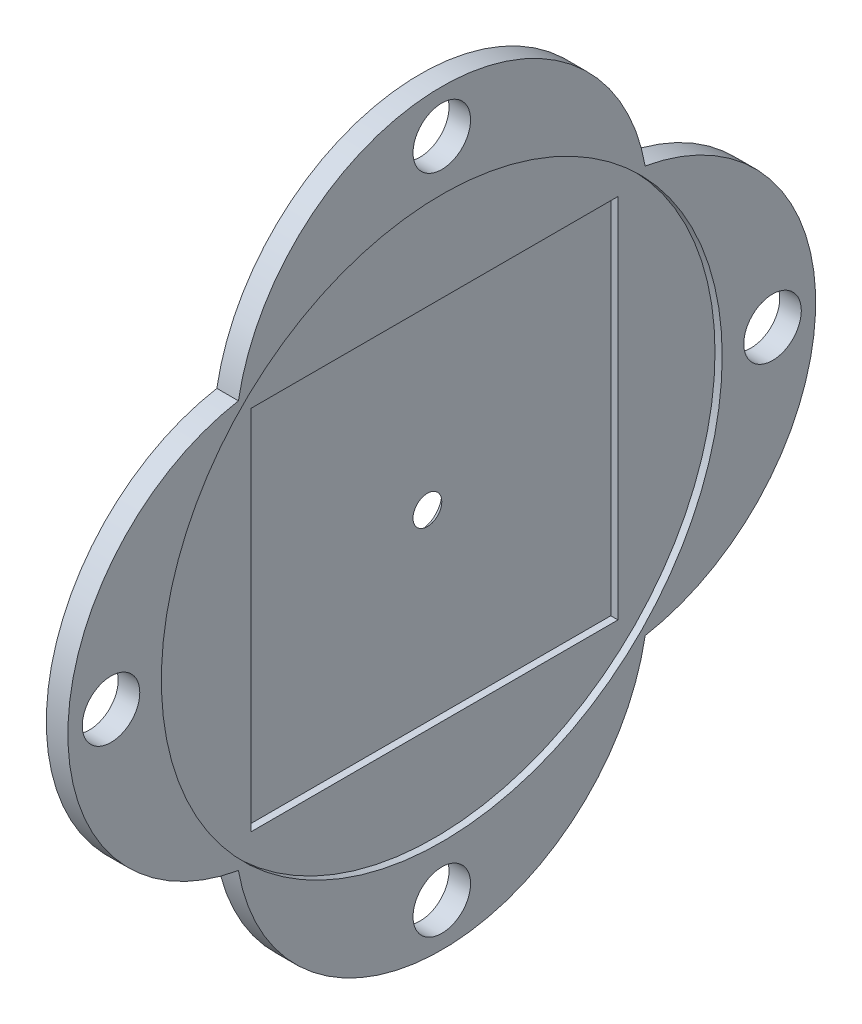
from build123d import *

# Parameters (mm, degrees)
SKETCH2_R          = 2
BODY_DEPTH         = 0.75
SKETCH3_R          = 19.5
O_RING_SEAT_DEPTH  = 0.5
SKETCH11_W         = 25.5
SKETCH11_H         = 25.5
MESH_RECESS_DEPTH  = 0.5
SKETCH12_R         = 0.5
CUT_EXTRUDE4_DEPTH = 37.783148315
CHAMFER1_SIZE      = 1


with BuildPart() as part:
    # Sketch2 → Body (new, symmetric)
    with BuildSketch(Plane(origin=(0, 0, 0), x_dir=(0, 0, -1), z_dir=(1, 0, 0))):
        with BuildLine():
            ThreePointArc((-14.142135624, 14.142135624), (-26, 0), (-14.142135624, -14.142135624))
            ThreePointArc((-14.142135624, -14.142135624), (0, -26), (14.142135624, -14.142135624))
            ThreePointArc((14.142135624, -14.142135624), (26, 0), (14.142135624, 14.142135624))
            ThreePointArc((14.142135624, 14.142135624), (0, 26), (-14.142135624, 14.142135624))
        make_face()
        with Locations((0, 23)):
            Circle(SKETCH2_R, mode=Mode.SUBTRACT)
        with Locations((23, 0)):
            Circle(SKETCH2_R, mode=Mode.SUBTRACT)
        with Locations((0, -23)):
            Circle(SKETCH2_R, mode=Mode.SUBTRACT)
        with Locations((-23, 0)):
            Circle(SKETCH2_R, mode=Mode.SUBTRACT)
    extrude(amount=BODY_DEPTH, both=True)

    # Sketch3 → O-Ring Seat (cut)
    with BuildSketch(Plane(origin=(0.75, 0, 0), x_dir=(0, 0, -1), z_dir=(1, 0, 0))):
        Circle(SKETCH3_R)
    extrude(amount=-O_RING_SEAT_DEPTH, mode=Mode.SUBTRACT)

    # Sketch11 → Mesh Recess (cut)
    with BuildSketch(Plane(origin=(0.25, 0, 0), x_dir=(0, 0, -1), z_dir=(1, 0, 0))):
        Rectangle(SKETCH11_W, SKETCH11_H)
    extrude(amount=-MESH_RECESS_DEPTH, mode=Mode.SUBTRACT)

    # Sketch12 → Cut-Extrude4 (cut, through all)
    with BuildSketch(Plane(origin=(-0.25, 0, 0), x_dir=(0, 0, -1), z_dir=(1, 0, 0))):
        Circle(SKETCH12_R)
    extrude(amount=-CUT_EXTRUDE4_DEPTH, mode=Mode.SUBTRACT)

    # Chamfer1
    # the kernel refuses this chamfer: 1 mm, written as the material it takes off along each edge
    with BuildSketch(Plane(origin=(-0.75, 0, 0), x_dir=(0, 0, -1), z_dir=(0, -1, 0))) as chamfer1_piece_1:
        Polygon((0.5 + CHAMFER1_SIZE, 0), (0.5, CHAMFER1_SIZE), (0.5, 0), align=None)
    revolve(axis=Axis((-0.75, 0, 0), (1, 0, 0)), mode=Mode.SUBTRACT)


solid = part.part
